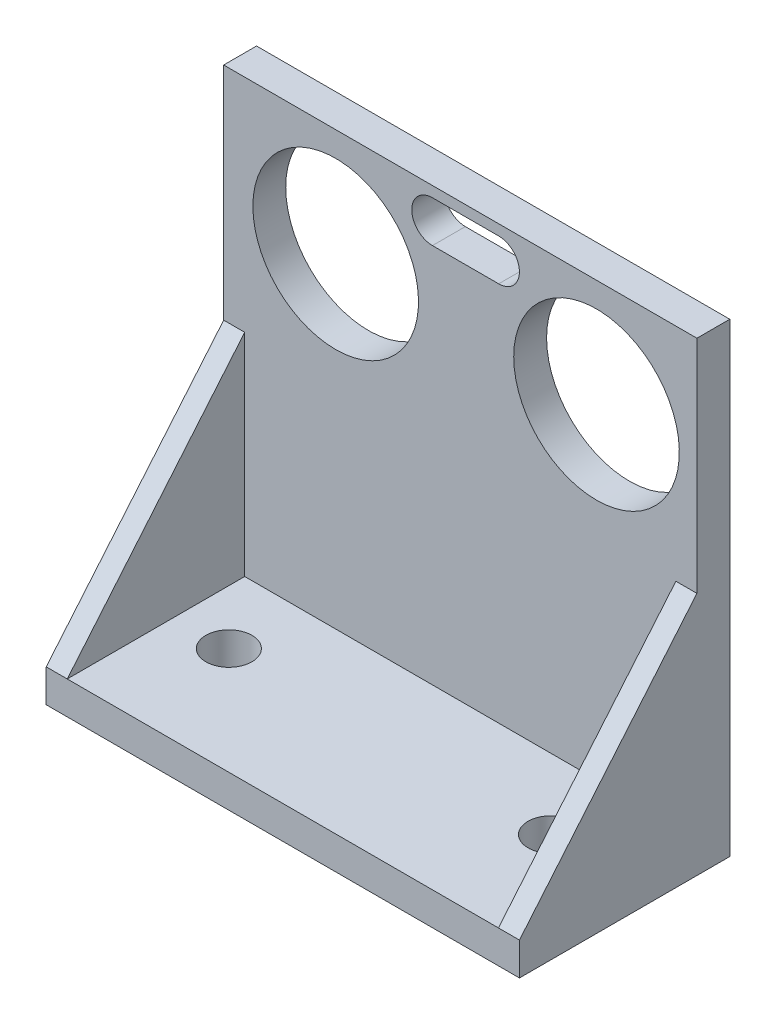
from build123d import *

# Parameters (mm, degrees)
SKETCH1_W           = 45.72
SKETCH1_H           = 20.32
BOSS_EXTRUDE1_DEPTH = 3.175
SKETCH2_W           = 3.175
SKETCH2_H           = 41.783
BOSS_EXTRUDE2_DEPTH = 45.72
SWEEP1_START        = -22.86
SWEEP1_DEPTH        = 2.032
SWEEP1_START_2      = 20.828
SWEEP1_2_DEPTH      = 2.032
SKETCH5_R           = 8
CUT_EXTRUDE1_DEPTH  = 55.375580585
SKETCH6_R           = 2.2225
CUT_EXTRUDE2_DEPTH  = 52.449265923


# Read off the part's stored shape, not the designer's step: Sweep1
with BuildPart() as part:
    # Sketch1 → Boss-Extrude1 (new body)
    with BuildSketch(Plane(origin=(0, 0, 0), x_dir=(1, 0, 0), z_dir=(0, 1, 0))):
        Rectangle(SKETCH1_W, SKETCH1_H)
    extrude(amount=BOSS_EXTRUDE1_DEPTH)

    # Sketch2 → Boss-Extrude2 (add)
    with BuildSketch(Plane(origin=(22.86, 0, 0), x_dir=(0, 0, -1), z_dir=(1, 0, 0))):
        with Locations((8.5725, 24.0665)):
            Rectangle(SKETCH2_W, SKETCH2_H)
    extrude(amount=-BOSS_EXTRUDE2_DEPTH)

    # Sweep1 outline → Sweep1 (add)
    with BuildSketch(Plane.YZ.offset(SWEEP1_START)):
        Polygon((3.175, -6.985), (23.607615345, -6.985), (3.175, 10.16), align=None)
    extrude(amount=SWEEP1_DEPTH)

    # Sweep1 2 outline → Sweep1 2 (add)
    with BuildSketch(Plane.YZ.offset(SWEEP1_START_2)):
        Polygon((3.175, -6.985), (23.607615345, -6.985), (3.175, 10.16), align=None)
    extrude(amount=SWEEP1_2_DEPTH)

    # Sketch5 → Cut-Extrude1 (cut, through all)
    with BuildSketch(Plane(origin=(0, 0, -10.16), x_dir=(-1, 0, 0), z_dir=(0, 0, -1))):
        with Locations((-13.16, 34.558)):
            Circle(SKETCH5_R)
        with Locations((12.04, 34.558)):
            Circle(SKETCH5_R)
        with BuildLine():
            Line((-3.71, 43.933), (2.69, 43.933))
            ThreePointArc((2.69, 43.933), (4.69, 41.933), (2.69, 39.933))
            Line((2.69, 39.933), (-3.71, 39.933))
            ThreePointArc((-3.71, 39.933), (-5.71, 41.933), (-3.71, 43.933))
        make_face()
    extrude(amount=-CUT_EXTRUDE1_DEPTH, mode=Mode.SUBTRACT)

    # Sketch6 → Cut-Extrude2 (cut, through all)
    with BuildSketch(Plane.XZ):
        with Locations(Location((-15.564885413, -0.190388698, 0), (0, 0, 270))):
            Circle(SKETCH6_R)
        with Locations(Location((15.5575, -0.190388698, 0), (0, 0, 270))):
            Circle(SKETCH6_R)
    extrude(amount=-CUT_EXTRUDE2_DEPTH, mode=Mode.SUBTRACT)


solid = part.part
